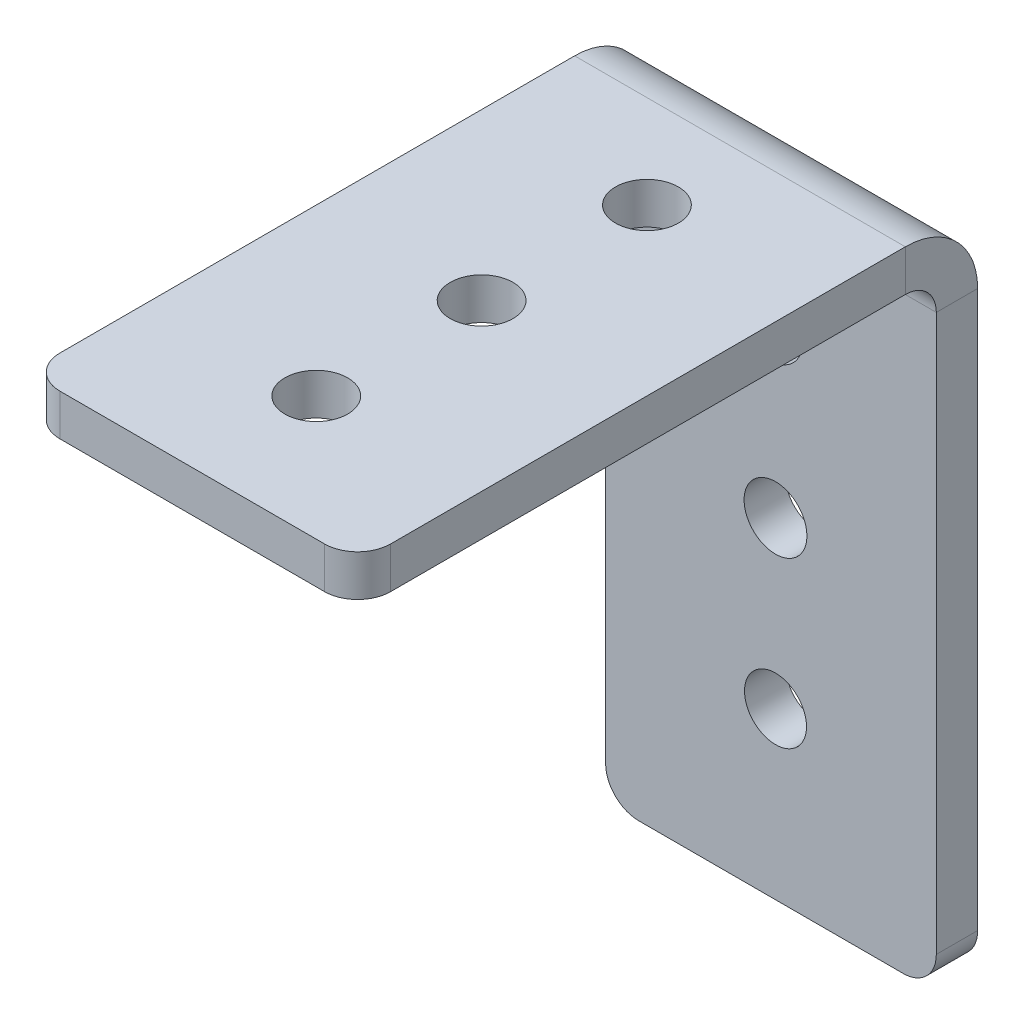
from build123d import *

# Parameters (mm, degrees)
SKETCH1_W              = 25.4
SKETCH1_H              = 50.8
SKETCH1_R              = 2.413
SKETCH1_R_2            = 2.38125
BOSS_EXTRUDE1_DEPTH    = 3.175
SKETCH2_W              = 25.4
SKETCH2_H              = 3.175
BOSS_EXTRUDE2_DEPTH    = 44.45
SKETCH3_R              = 2.413
CUT_EXTRUDE1_DEPTH     = 44.45
FILLET1_R              = 2.54
CONVERT_SOLID1_START   = -12.7
CONVERT_SOLID1_DEPTH   = 25.4
CONVERT_SOLID1_2_DEPTH = 25.4


# Read off the part's stored shape, not the designer's step: Convert-Solid1
with BuildPart() as part:
    # Sketch1 → Boss-Extrude1 (new body)
    with BuildSketch(Plane.XY):
        Rectangle(SKETCH1_W, SKETCH1_H)
        with Locations((0, 12.7)):
            Circle(SKETCH1_R, mode=Mode.SUBTRACT)
        with Locations((0.348627451, 0)):
            Circle(SKETCH1_R, mode=Mode.SUBTRACT)
        with Locations((0.348627451, -12.7)):
            Circle(SKETCH1_R_2, mode=Mode.SUBTRACT)
    extrude(amount=BOSS_EXTRUDE1_DEPTH)

    # Sketch2 → Boss-Extrude2 (add)
    with BuildSketch(Plane.XY.offset(3.175)):
        with Locations((0, 23.8125)):
            Rectangle(SKETCH2_W, SKETCH2_H)
    extrude(amount=BOSS_EXTRUDE2_DEPTH)

    # Sketch3 → Cut-Extrude1 (cut)
    with BuildSketch(Plane(origin=(0, 25.4, 0), x_dir=(1, 0, 0), z_dir=(0, 1, 0))):
        with Locations(Location((0, -12.7, 0), (0, 0, 270))):
            Circle(SKETCH3_R)
        with Locations(Location((0, -25.4, 0), (0, 0, 270))):
            Circle(SKETCH3_R)
        with Locations(Location((0, -38.1, 0), (0, 0, 270))):
            Circle(SKETCH3_R)
    extrude(amount=-CUT_EXTRUDE1_DEPTH, mode=Mode.SUBTRACT)

    # Fillet1
    fillet1_edges = [part.edges().sort_by_distance(p)[0] for p in [
        (-12.7, 23.8125, 47.625),
        (12.7, 23.8125, 47.625),
        (12.7, -25.4, 1.5875),
        (-12.7, -25.4, 1.5875),
    ]]
    fillet(fillet1_edges, radius=FILLET1_R)

    # Convert-Solid1 outline → Convert-Solid1 (cut)
    with BuildSketch(Plane.YZ.offset(CONVERT_SOLID1_START)):
        with BuildLine():
            Line((25.4, 0), (25.4, 5.555000066))
            ThreePointArc((25.4, 5.555000066), (23.77297815, 1.62702185), (19.844999934, 0))
            Line((19.844999934, 0), (25.4, 0))
        make_face()
    extrude(amount=CONVERT_SOLID1_DEPTH, mode=Mode.SUBTRACT)

    # Convert-Solid1 2 outline → Convert-Solid1 2 (add)
    with BuildSketch(Plane.YZ.offset(CONVERT_SOLID1_START)):
        with BuildLine():
            Line((22.225, 3.175), (22.225, 5.555000066))
            ThreePointArc((22.225, 5.555000066), (21.52791412, 3.87208588), (19.844999934, 3.175))
            Line((19.844999934, 3.175), (22.225, 3.175))
        make_face()
    extrude(amount=CONVERT_SOLID1_2_DEPTH)


solid = part.part
